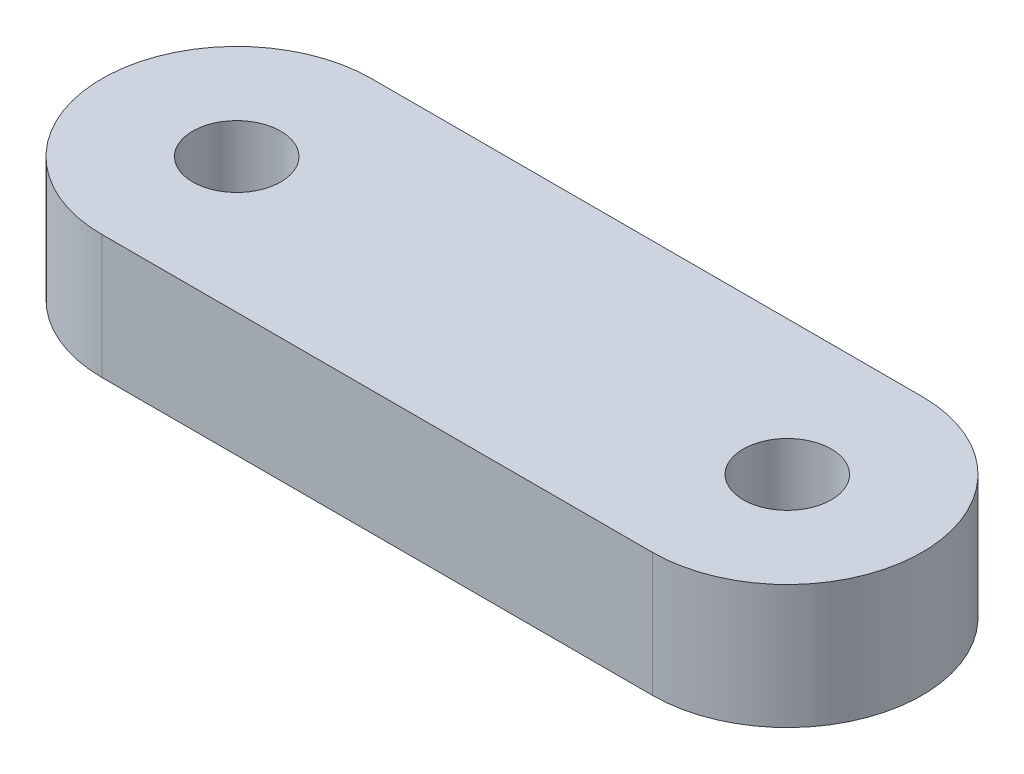
from build123d import *

# Parameters (mm, degrees)
SKETCH1_R           = 1.6
BOSS_EXTRUDE1_DEPTH = 4.5


with BuildPart() as part:
    # Sketch1 → Boss-Extrude1 (new body)
    with BuildSketch(Plane(origin=(0, 0, 0), x_dir=(1, 0, 0), z_dir=(0, 1, 0))):
        with BuildLine():
            Line((-10.000000241, 4.9), (10.000000241, 4.9))
            ThreePointArc((10.000000241, 4.9), (14.9, 0), (10.000000241, -4.9))
            Line((10.000000241, -4.9), (-10.000000241, -4.9))
            ThreePointArc((-10.000000241, -4.9), (-14.9, 0), (-10.000000241, 4.9))
        make_face()
        with Locations((-10, 0)):
            Circle(SKETCH1_R, mode=Mode.SUBTRACT)
        with Locations((10, 0)):
            Circle(SKETCH1_R, mode=Mode.SUBTRACT)
    extrude(amount=BOSS_EXTRUDE1_DEPTH)


solid = part.part
